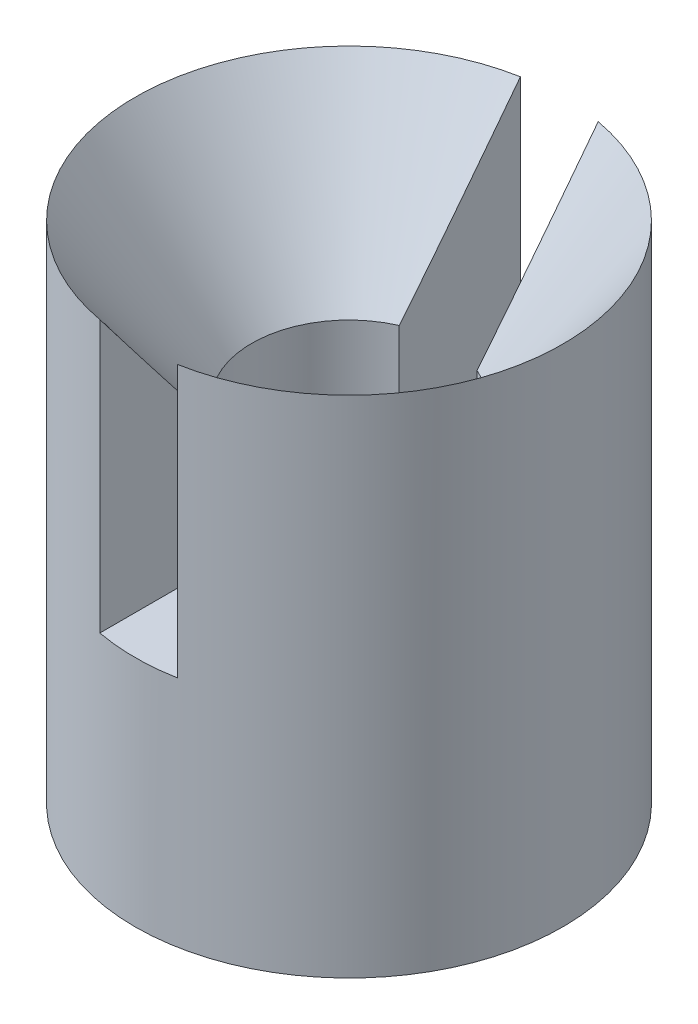
from build123d import *

# Parameters (mm, degrees)
SKETCH1_R           = 5.5
BOSS_EXTRUDE1_DEPTH = 13
SKETCH2_R           = 2.5
CUT_EXTRUDE1_DEPTH  = 16.149257408
CHAMFER1_SIZE       = 3.0142162
CHAMFER1_SIZE_2     = 4
SKETCH4_W           = 2
SKETCH4_H           = 12
CUT_EXTRUDE2_DEPTH  = 7
SKETCH5_R           = 1
CUT_EXTRUDE3_DEPTH  = 7


with BuildPart() as part:
    # Sketch1 → Boss-Extrude1 (new body)
    with BuildSketch(Plane(origin=(0, 0, 0), x_dir=(1, 0, 0), z_dir=(0, 1, 0))):
        with Locations(Location((0, 0, 0), (0, 0, 90))):
            Circle(SKETCH1_R)
    extrude(amount=BOSS_EXTRUDE1_DEPTH)

    # Sketch2 → Cut-Extrude1 (cut, through all)
    with BuildSketch(Plane.XZ):
        with Locations(Location((0, 0, 0), (0, 0, 270))):
            Circle(SKETCH2_R)
    extrude(amount=-CUT_EXTRUDE1_DEPTH, mode=Mode.SUBTRACT)

    # Chamfer1
    # the kernel refuses this chamfer: 4, 3.0142162 mm, written as the material it takes off along each edge
    with BuildSketch(Plane(origin=(0, 13, 0), x_dir=(0, 0, -1), z_dir=(-1, 0, 0))) as chamfer1_piece_1:
        Polygon((2.5 + CHAMFER1_SIZE, 0), (2.5, CHAMFER1_SIZE_2), (2.5, 0), align=None)
    revolve(axis=Axis((0, 13, 0), (0, -1, 0)), mode=Mode.SUBTRACT)

    # Sketch4 → Cut-Extrude2 (cut)
    with BuildSketch(Plane(origin=(0, 13, 0), x_dir=(1, 0, 0), z_dir=(0, 1, 0))):
        Rectangle(SKETCH4_W, SKETCH4_H)
    extrude(amount=-CUT_EXTRUDE2_DEPTH, mode=Mode.SUBTRACT)

    # Sketch5 → Cut-Extrude3 (cut)
    with BuildSketch(Plane(origin=(0, 0, 0), x_dir=(0, 0, -1), z_dir=(1, 0, 0))):
        with Locations((0, 3)):
            Circle(SKETCH5_R)
    extrude(amount=-CUT_EXTRUDE3_DEPTH, mode=Mode.SUBTRACT)


solid = part.part
